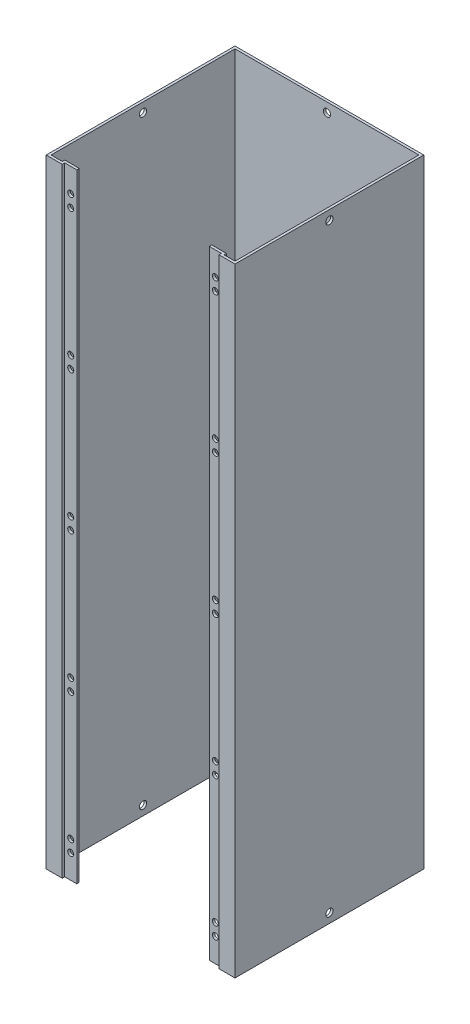
from build123d import *

# Parameters (mm, degrees)
BOSS_EXTRUDE1_DEPTH = 327.5
SKETCH2_R           = 1.6
CUT_EXTRUDE2_DEPTH  = 10
SKETCH3_R           = 1.93
CUT_EXTRUDE3_DEPTH  = 100
SKETCH4_R           = 1.93
CUT_EXTRUDE4_DEPTH  = 10


with BuildPart() as part:
    # Sketch1 → Boss-Extrude1 (new body)
    with BuildSketch(Plane(origin=(0, 0, 0), x_dir=(1, 0, 0), z_dir=(0, 1, 0))):
        Polygon((0, 0), (0, 100), (100, 100), (100, 0), (91.5, 0), (91.5, 1.3), (85.1, 1.3), (85.1, 2.6), (92.8, 2.6), (92.8, 1.3), (98.7, 1.3), (98.7, 98.7), (1.3, 98.7), (1.3, 1.3), (7.2, 1.3), (7.2, 2.6), (14.9, 2.6), (14.9, 1.3), (8.5, 1.3), (8.5, 0), align=None)
    extrude(amount=BOSS_EXTRUDE1_DEPTH)

    # Sketch2 → Cut-Extrude2 (cut)
    with BuildSketch(Plane.XY.offset(-1.3)):
        with Locations((11.7, 314.9)):
            Circle(SKETCH2_R)
        with Locations((11.7, 308.5)):
            Circle(SKETCH2_R)
        with Locations((88.3, 314.9)):
            Circle(SKETCH2_R)
        with Locations((88.3, 308.5)):
            Circle(SKETCH2_R)
        with Locations((11.7, 240.925)):
            Circle(SKETCH2_R)
        with Locations((11.7, 234.525)):
            Circle(SKETCH2_R)
        with Locations((88.3, 240.925)):
            Circle(SKETCH2_R)
        with Locations((88.3, 234.525)):
            Circle(SKETCH2_R)
        with Locations((11.7, 166.95)):
            Circle(SKETCH2_R)
        with Locations((11.7, 160.55)):
            Circle(SKETCH2_R)
        with Locations((88.3, 166.95)):
            Circle(SKETCH2_R)
        with Locations((88.3, 160.55)):
            Circle(SKETCH2_R)
        with Locations((11.7, 92.975)):
            Circle(SKETCH2_R)
        with Locations((11.7, 86.575)):
            Circle(SKETCH2_R)
        with Locations((88.3, 92.975)):
            Circle(SKETCH2_R)
        with Locations((88.3, 86.575)):
            Circle(SKETCH2_R)
        with Locations((11.7, 19)):
            Circle(SKETCH2_R)
        with Locations((11.7, 12.6)):
            Circle(SKETCH2_R)
        with Locations((88.3, 19)):
            Circle(SKETCH2_R)
        with Locations((88.3, 12.6)):
            Circle(SKETCH2_R)
    extrude(amount=-CUT_EXTRUDE2_DEPTH, mode=Mode.SUBTRACT)

    # Sketch3 → Cut-Extrude3 (cut)
    with BuildSketch(Plane(origin=(100, 0, 0), x_dir=(0, 0, -1), z_dir=(1, 0, 0))):
        with Locations((50, 322.524)):
            Circle(SKETCH3_R)
        with Locations((50, 4.976)):
            Circle(SKETCH3_R)
    extrude(amount=-CUT_EXTRUDE3_DEPTH, mode=Mode.SUBTRACT)

    # Sketch4 → Cut-Extrude4 (cut)
    with BuildSketch(Plane(origin=(0, 0, -100), x_dir=(-1, 0, 0), z_dir=(0, 0, -1))):
        with Locations((-50, 322.524)):
            Circle(SKETCH4_R)
        with Locations((-50, 4.976)):
            Circle(SKETCH4_R)
    extrude(amount=-CUT_EXTRUDE4_DEPTH, mode=Mode.SUBTRACT)


solid = part.part
